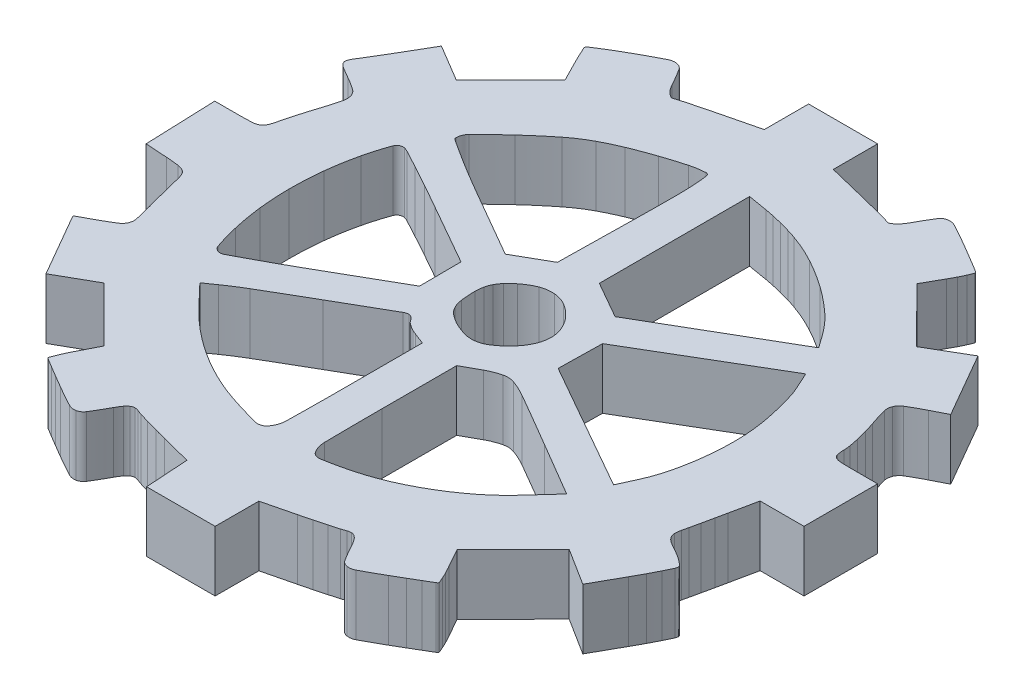
from build123d import *

# Parameters (mm, degrees)
BOSS_EXTRUDE2_DEPTH = 1
SCALE1_SCALE        = 25


with BuildPart() as part:
    # Sketch1 → Boss-Extrude2 (new body)
    with BuildSketch(Plane(origin=(0, 0, 0), x_dir=(1, 0, 0), z_dir=(0, 1, 0))):
        with BuildLine():
            Line((6921.747440723, 9184.288829947), (6921.747440723, 9183.921762584))
            Line((6921.747440723, 9183.921762584), (6921.194990723, 9183.786313121))
            ThreePointArc((6921.194990723, 9183.786313121), (6921.085826929, 9183.759302328), (6920.976778916, 9183.731827835))
            ThreePointArc((6920.976778916, 9183.731827835), (6920.877395392, 9183.706267667), (6920.778156301, 9183.680152348))
            ThreePointArc((6920.778156301, 9183.680152348), (6920.695117461, 9183.657870929), (6920.612169994, 9183.635251727))
            ThreePointArc((6920.612169994, 9183.635251727), (6920.581696467, 9183.625993034), (6920.551760767, 9183.615120449))
            ThreePointArc((6920.551760767, 9183.615120449), (6920.530041277, 9183.611412643), (6920.50865458, 9183.616712953))
            ThreePointArc((6920.50865458, 9183.616712953), (6920.479922998, 9183.632968304), (6920.453577753, 9183.652859718))
            ThreePointArc((6920.453577753, 9183.652859718), (6920.423190417, 9183.68206586), (6920.39606024, 9183.7143202))
            ThreePointArc((6920.39606024, 9183.7143202), (6920.369033733, 9183.75309256), (6920.344999001, 9183.793787275))
            ThreePointArc((6920.344999001, 9183.793787275), (6920.264288851, 9183.937151041), (6920.178781884, 9184.07770657))
            ThreePointArc((6920.178781884, 9184.07770657), (6920.135311918, 9184.12257325), (6920.077505378, 9184.146259976))
            ThreePointArc((6920.077505378, 9184.146259976), (6920.010208867, 9184.147556371), (6919.946060759, 9184.127172028))
            ThreePointArc((6919.946060759, 9184.127172028), (6919.764517255, 9184.032465207), (6919.584842889, 9183.934258546))
            ThreePointArc((6919.584842889, 9183.934258546), (6919.487894186, 9183.879418137), (6919.391485999, 9183.823632986))
            ThreePointArc((6919.391485999, 9183.823632986), (6919.309662911, 9183.774892753), (6919.22860888, 9183.724884034))
            ThreePointArc((6919.22860888, 9183.724884034), (6919.159887773, 9183.681478172), (6919.091406436, 9183.637695004))
            ThreePointArc((6919.091406436, 9183.637695004), (6919.083360598, 9183.629048012), (6919.080440723, 9183.61760335))
            ThreePointArc((6919.080440723, 9183.61760335), (6919.081695775, 9183.605571698), (6919.085406905, 9183.594058083))
            ThreePointArc((6919.085406905, 9183.594058083), (6919.105309047, 9183.549382505), (6919.125509441, 9183.504840989))
            ThreePointArc((6919.125509441, 9183.504840989), (6919.149963229, 9183.452277609), (6919.175079751, 9183.400027661))
            ThreePointArc((6919.175079751, 9183.400027661), (6919.204217902, 9183.341030009), (6919.233866222, 9183.282287078))
            Line((6919.233866222, 9183.282287078), (6919.387291722, 9182.981548234))
            Line((6919.387291722, 9182.981548234), (6918.937246369, 9182.53150288))
            Line((6918.937246369, 9182.53150288), (6918.487201015, 9182.081457527))
            Line((6918.487201015, 9182.081457527), (6918.181462003, 9182.263778219))
            Line((6918.181462003, 9182.263778219), (6917.875723066, 9182.446098987))
            Line((6917.875723066, 9182.446098987), (6917.665374566, 9182.084148073))
            ThreePointArc((6917.665374566, 9182.084148073), (6917.621370149, 9182.008753708), (6917.577084065, 9181.933524447))
            ThreePointArc((6917.577084065, 9181.933524447), (6917.53155033, 9181.856812764), (6917.485748078, 9181.780261101))
            ThreePointArc((6917.485748078, 9181.780261101), (6917.444867268, 9181.712473862), (6917.403750401, 9181.644829546))
            ThreePointArc((6917.403750401, 9181.644829546), (6917.376768388, 9181.601206039), (6917.34926321, 9181.557910492))
            ThreePointArc((6917.34926321, 9181.557910492), (6917.321496434, 9181.509132302), (6917.2991992, 9181.457623672))
            ThreePointArc((6917.2991992, 9181.457623672), (6917.294825961, 9181.424230965), (6917.305337415, 9181.392235537))
            ThreePointArc((6917.305337415, 9181.392235537), (6917.332293838, 9181.357460395), (6917.366643363, 9181.329963678))
            ThreePointArc((6917.366643363, 9181.329963678), (6917.458890692, 9181.273955219), (6917.5523705, 9181.220028947))
            ThreePointArc((6917.5523705, 9181.220028947), (6917.660813164, 9181.1552262), (6917.765656281, 9181.084748344))
            ThreePointArc((6917.765656281, 9181.084748344), (6917.811093989, 9181.039333836), (6917.839167259, 9180.981550151))
            ThreePointArc((6917.839167259, 9180.981550151), (6917.849727433, 9180.912453014), (6917.841628595, 9180.843024342))
            ThreePointArc((6917.841628595, 9180.843024342), (6917.79975148, 9180.688664606), (6917.753292831, 9180.535621426))
            ThreePointArc((6917.753292831, 9180.535621426), (6917.730593698, 9180.463459434), (6917.708598483, 9180.39107978))
            ThreePointArc((6917.708598483, 9180.39107978), (6917.685774646, 9180.313509825), (6917.663570379, 9180.235760253))
            ThreePointArc((6917.663570379, 9180.235760253), (6917.643724028, 9180.164095816), (6917.624455928, 9180.092273748))
            ThreePointArc((6917.624455928, 9180.092273748), (6917.611398967, 9180.040593145), (6917.599441069, 9179.988647234))
            ThreePointArc((6917.599441069, 9179.988647234), (6917.582736182, 9179.928042081), (6917.559677318, 9179.869558522))
            ThreePointArc((6917.559677318, 9179.869558522), (6917.536169503, 9179.83524724), (6917.502476569, 9179.810861433))
            ThreePointArc((6917.502476569, 9179.810861433), (6917.453205805, 9179.792687091), (6917.401285712, 9179.784799204))
            ThreePointArc((6917.401285712, 9179.784799204), (6917.286069956, 9179.78052291), (6917.170783684, 9179.779097234))
            Line((6917.170783684, 9179.779097234), (6916.788030093, 9179.779097234))
            Line((6916.788030093, 9179.779097234), (6916.810285446, 9179.188547234))
            Line((6916.810285446, 9179.188547234), (6916.832540723, 9178.597997234))
            Line((6916.832540723, 9178.597997234), (6917.194082672, 9178.574788848))
            ThreePointArc((6917.194082672, 9178.574788848), (6917.298237252, 9178.566474134), (6917.402082764, 9178.554923356))
            ThreePointArc((6917.402082764, 9178.554923356), (6917.454321, 9178.543089976), (6917.503322465, 9178.521463174))
            ThreePointArc((6917.503322465, 9178.521463174), (6917.537201906, 9178.494937135), (6917.561574317, 9178.459476836))
            ThreePointArc((6917.561574317, 9178.459476836), (6917.584490121, 9178.403978817), (6917.600783789, 9178.346188848))
            ThreePointArc((6917.600783789, 9178.346188848), (6917.612852086, 9178.292985854), (6917.625625294, 9178.239947684))
            ThreePointArc((6917.625625294, 9178.239947684), (6917.645591237, 9178.160092836), (6917.66588282, 9178.080320114))
            ThreePointArc((6917.66588282, 9178.080320114), (6917.688956193, 9177.991136237), (6917.712393243, 9177.902047242))
            ThreePointArc((6917.712393243, 9177.902047242), (6917.735495047, 9177.815734545), (6917.758982609, 9177.729526022))
            ThreePointArc((6917.758982609, 9177.729526022), (6917.796596702, 9177.584378533), (6917.829938068, 9177.43819041))
            ThreePointArc((6917.829938068, 9177.43819041), (6917.833095082, 9177.377749813), (6917.817384651, 9177.319301417))
            ThreePointArc((6917.817384651, 9177.319301417), (6917.784213495, 9177.267603381), (6917.737206554, 9177.228064033))
            ThreePointArc((6917.737206554, 9177.228064033), (6917.602142808, 9177.147875691), (6917.465032651, 9177.071238947))
            Line((6917.465032651, 9177.071238947), (6917.259324655, 9176.959757051))
            Line((6917.259324655, 9176.959757051), (6917.563326002, 9176.432473778))
            Line((6917.563326002, 9176.432473778), (6917.86732735, 9175.905190504))
            Line((6917.86732735, 9175.905190504), (6918.173456735, 9176.07907517))
            Line((6918.173456735, 9176.07907517), (6918.479586121, 9176.252959837))
            Line((6918.479586121, 9176.252959837), (6918.931379578, 9175.801166379))
            Line((6918.931379578, 9175.801166379), (6919.383173036, 9175.349372921))
            Line((6919.383173036, 9175.349372921), (6919.226491053, 9175.042250879))
            ThreePointArc((6919.226491053, 9175.042250879), (6919.196819352, 9174.982814303), (6919.168189138, 9174.922869101))
            ThreePointArc((6919.168189138, 9174.922869101), (6919.144866453, 9174.87105549), (6919.12299187, 9174.81861409))
            ThreePointArc((6919.12299187, 9174.81861409), (6919.105963647, 9174.775172656), (6919.089607888, 9174.731473598))
            ThreePointArc((6919.089607888, 9174.731473598), (6919.089000512, 9174.721157309), (6919.094174935, 9174.712211915))
            ThreePointArc((6919.094174935, 9174.712211915), (6919.103798436, 9174.704072762), (6919.114225364, 9174.696992032))
            ThreePointArc((6919.114225364, 9174.696992032), (6919.184052354, 9174.654834379), (6919.253933416, 9174.612766419))
            ThreePointArc((6919.253933416, 9174.612766419), (6919.334909361, 9174.564300222), (6919.416069566, 9174.516143219))
            ThreePointArc((6919.416069566, 9174.516143219), (6919.50987499, 9174.460882255), (6919.603817832, 9174.405855225))
            ThreePointArc((6919.603817832, 9174.405855225), (6919.776580624, 9174.307278913), (6919.951302634, 9174.212218452))
            ThreePointArc((6919.951302634, 9174.212218452), (6920.013668597, 9174.191601391), (6920.079342789, 9174.192816713))
            ThreePointArc((6920.079342789, 9174.192816713), (6920.136284543, 9174.216431521), (6920.179028315, 9174.260849902))
            ThreePointArc((6920.179028315, 9174.260849902), (6920.264664599, 9174.402338653), (6920.345679544, 9174.546523321))
            ThreePointArc((6920.345679544, 9174.546523321), (6920.3751525, 9174.597224978), (6920.407692094, 9174.646015222))
            ThreePointArc((6920.407692094, 9174.646015222), (6920.433744096, 9174.676179132), (6920.464944126, 9174.700980873))
            ThreePointArc((6920.464944126, 9174.700980873), (6920.493279321, 9174.714306333), (6920.524180177, 9174.719364809))
            ThreePointArc((6920.524180177, 9174.719364809), (6920.558071605, 9174.716473116), (6920.590541309, 9174.706338571))
            ThreePointArc((6920.590541309, 9174.706338571), (6920.628867759, 9174.690862834), (6920.667986646, 9174.677516378))
            ThreePointArc((6920.667986646, 9174.677516378), (6920.74718247, 9174.65326426), (6920.826576524, 9174.629669179))
            ThreePointArc((6920.826576524, 9174.629669179), (6920.92066949, 9174.6026028), (6921.015009523, 9174.576410561))
            ThreePointArc((6921.015009523, 9174.576410561), (6921.114420185, 9174.549732653), (6921.214040723, 9174.523849477))
            Line((6921.214040723, 9174.523849477), (6921.709340723, 9174.397271219))
            Line((6921.709340723, 9174.397271219), (6921.732565797, 9174.040184227))
            Line((6921.732565797, 9174.040184227), (6921.755790871, 9173.683097234))
            Line((6921.755790871, 9173.683097234), (6922.323115797, 9173.683097234))
            Line((6922.323115797, 9173.683097234), (6922.890440723, 9173.683097234))
            Line((6922.890440723, 9173.683097234), (6922.89097839, 9174.045047234))
            Line((6922.89097839, 9174.045047234), (6922.891516057, 9174.406997234))
            Line((6922.891516057, 9174.406997234), (6923.40532839, 9174.533029215))
            ThreePointArc((6923.40532839, 9174.533029215), (6923.508476724, 9174.55869932), (6923.611449542, 9174.585064671))
            ThreePointArc((6923.611449542, 9174.585064671), (6923.708761782, 9174.610743661), (6923.805866908, 9174.637195072))
            ThreePointArc((6923.805866908, 9174.637195072), (6923.887683742, 9174.660139265), (6923.969338387, 9174.683654136))
            ThreePointArc((6923.969338387, 9174.683654136), (6924.008672578, 9174.696191826), (6924.047340136, 9174.710655301))
            ThreePointArc((6924.047340136, 9174.710655301), (6924.079571763, 9174.719548321), (6924.112977673, 9174.720965618))
            ThreePointArc((6924.112977673, 9174.720965618), (6924.144266999, 9174.71459418), (6924.172870187, 9174.7004))
            ThreePointArc((6924.172870187, 9174.7004), (6924.204404181, 9174.67492367), (6924.230927577, 9174.644265137))
            ThreePointArc((6924.230927577, 9174.644265137), (6924.263134522, 9174.596378325), (6924.292201902, 9174.546523321))
            ThreePointArc((6924.292201902, 9174.546523321), (6924.371167996, 9174.406319255), (6924.454907876, 9174.268913081))
            ThreePointArc((6924.454907876, 9174.268913081), (6924.497756479, 9174.224874725), (6924.554709226, 9174.201814714))
            ThreePointArc((6924.554709226, 9174.201814714), (6924.620795611, 9174.20102205), (6924.683550548, 9174.221755034))
            ThreePointArc((6924.683550548, 9174.221755034), (6924.858403916, 9174.316079208), (6925.031321938, 9174.413906136))
            ThreePointArc((6925.031321938, 9174.413906136), (6925.125854708, 9174.468763329), (6925.220290013, 9174.523788136))
            ThreePointArc((6925.220290013, 9174.523788136), (6925.302130187, 9174.571719956), (6925.383840359, 9174.61987306))
            Line((6925.383840359, 9174.61987306), (6925.524808378, 9174.703382011))
            ThreePointArc((6925.524808378, 9174.703382011), (6925.535714594, 9174.710404967), (6925.546081665, 9174.718201844))
            ThreePointArc((6925.546081665, 9174.718201844), (6925.551644853, 9174.726855392), (6925.550975153, 9174.737121085))
            ThreePointArc((6925.550975153, 9174.737121085), (6925.533133249, 9174.780305771), (6925.514568241, 9174.823184566))
            ThreePointArc((6925.514568241, 9174.823184566), (6925.490591254, 9174.875234731), (6925.465096838, 9174.926558705))
            ThreePointArc((6925.465096838, 9174.926558705), (6925.433712339, 9174.986144008), (6925.401250916, 9175.045149527))
            Line((6925.401250916, 9175.045149527), (6925.229679301, 9175.350419986))
            Line((6925.229679301, 9175.350419986), (6925.692040327, 9175.817103914))
            Line((6925.692040327, 9175.817103914), (6926.154401353, 9176.283787918))
            Line((6926.154401353, 9176.283787918), (6926.460278897, 9176.090695899))
            Line((6926.460278897, 9176.090695899), (6926.766156441, 9175.89760388))
            Line((6926.766156441, 9175.89760388), (6927.038098544, 9176.383881952))
            ThreePointArc((6927.038098544, 9176.383881952), (6927.090703132, 9176.479138184), (6927.142287413, 9176.574950785))
            ThreePointArc((6927.142287413, 9176.574950785), (6927.186880391, 9176.660422722), (6927.230157748, 9176.746568273))
            ThreePointArc((6927.230157748, 9176.746568273), (6927.265568108, 9176.819244253), (6927.300323546, 9176.892235698))
            ThreePointArc((6927.300323546, 9176.892235698), (6927.307581821, 9176.913431567), (6927.310040723, 9176.935700407))
            ThreePointArc((6927.310040723, 9176.935700407), (6927.306253306, 9176.95393162), (6927.295517841, 9176.969145806))
            ThreePointArc((6927.295517841, 9176.969145806), (6927.263358258, 9176.997870592), (6927.229942636, 9177.025124002))
            ThreePointArc((6927.229942636, 9177.025124002), (6927.186639835, 9177.057175506), (6927.141815583, 9177.087062258))
            ThreePointArc((6927.141815583, 9177.087062258), (6927.090121232, 9177.118481554), (6927.037366414, 9177.148085732))
            ThreePointArc((6927.037366414, 9177.148085732), (6926.963421776, 9177.189988968), (6926.891352508, 9177.235041286))
            ThreePointArc((6926.891352508, 9177.235041286), (6926.853410547, 9177.265797621), (6926.822405147, 9177.303536323))
            ThreePointArc((6926.822405147, 9177.303536323), (6926.804919953, 9177.34035611), (6926.798571083, 9177.380619253))
            ThreePointArc((6926.798571083, 9177.380619253), (6926.801207566, 9177.435306036), (6926.810489296, 9177.489263841))
            ThreePointArc((6926.810489296, 9177.489263841), (6926.822461461, 9177.540837691), (6926.834088436, 9177.592490457))
            ThreePointArc((6926.834088436, 9177.592490457), (6926.852035473, 9177.673837956), (6926.869832637, 9177.755218376))
            ThreePointArc((6926.869832637, 9177.755218376), (6926.889827179, 9177.847464079), (6926.909650109, 9177.939746811))
            ThreePointArc((6926.909650109, 9177.939746811), (6926.929012589, 9178.030728288), (6926.948198165, 9178.121747234))
            Line((6926.948198165, 9178.121747234), (6927.040109767, 9178.559897234))
            Line((6927.040109767, 9178.559897234), (6927.403675207, 9178.559897234))
            Line((6927.403675207, 9178.559897234), (6927.767240723, 9178.559897234))
            Line((6927.767240723, 9178.559897234), (6927.767240723, 9179.169497234))
            Line((6927.767240723, 9179.169497234), (6927.767240723, 9179.779097234))
            Line((6927.767240723, 9179.779097234), (6927.386240723, 9179.779097234))
            ThreePointArc((6927.386240723, 9179.779097234), (6927.267350965, 9179.780297659), (6927.148509677, 9179.783898215))
            ThreePointArc((6927.148509677, 9179.783898215), (6927.102221093, 9179.791145773), (6927.058801246, 9179.808749093))
            ThreePointArc((6927.058801246, 9179.808749093), (6927.031378777, 9179.832579983), (6927.016409509, 9179.865683218))
            ThreePointArc((6927.016409509, 9179.865683218), (6927.0065436, 9179.926827858), (6927.002753098, 9179.988647234))
            ThreePointArc((6927.002753098, 9179.988647234), (6926.999907657, 9180.042485008), (6926.992669171, 9180.095909783))
            ThreePointArc((6926.992669171, 9180.095909783), (6926.97753385, 9180.175284671), (6926.960368981, 9180.254245535))
            ThreePointArc((6926.960368981, 9180.254245535), (6926.938844618, 9180.342360789), (6926.915086979, 9180.429900327))
            ThreePointArc((6926.915086979, 9180.429900327), (6926.889680948, 9180.514589686), (6926.861960034, 9180.598549825))
            ThreePointArc((6926.861960034, 9180.598549825), (6926.816318303, 9180.739157731), (6926.77598045, 9180.881378012))
            ThreePointArc((6926.77598045, 9180.881378012), (6926.769782902, 9180.946547173), (6926.784757775, 9181.010274579))
            ThreePointArc((6926.784757775, 9181.010274579), (6926.819415066, 9181.066454542), (6926.86991318, 9181.108966381))
            ThreePointArc((6926.86991318, 9181.108966381), (6927.001035177, 9181.184547888), (6927.134748795, 9181.255443659))
            Line((6927.134748795, 9181.255443659), (6927.378556791, 9181.379237417))
            Line((6927.378556791, 9181.379237417), (6927.071290959, 9181.912182808))
            Line((6927.071290959, 9181.912182808), (6926.764025127, 9182.445128275))
            Line((6926.764025127, 9182.445128275), (6926.442515839, 9182.256711202))
            Line((6926.442515839, 9182.256711202), (6926.121006474, 9182.068294205))
            Line((6926.121006474, 9182.068294205), (6925.671838259, 9182.522198708))
            Line((6925.671838259, 9182.522198708), (6925.222670044, 9182.976103134))
            Line((6925.222670044, 9182.976103134), (6925.397746325, 9183.287609267))
            ThreePointArc((6925.397746325, 9183.287609267), (6925.430904686, 9183.347921424), (6925.462928415, 9183.40884362))
            ThreePointArc((6925.462928415, 9183.40884362), (6925.489026566, 9183.46156393), (6925.513538779, 9183.515040055))
            ThreePointArc((6925.513538779, 9183.515040055), (6925.532496033, 9183.559128438), (6925.550676144, 9183.603542926))
            ThreePointArc((6925.550676144, 9183.603542926), (6925.55158592, 9183.614681366), (6925.546081665, 9183.6244074))
            ThreePointArc((6925.546081665, 9183.6244074), (6925.535606657, 9183.633312871), (6925.524248689, 9183.641060758))
            ThreePointArc((6925.524248689, 9183.641060758), (6925.454479681, 9183.683349237), (6925.384645717, 9183.725530363))
            ThreePointArc((6925.384645717, 9183.725530363), (6925.303413434, 9183.774278086), (6925.221976547, 9183.822683229))
            ThreePointArc((6925.221976547, 9183.822683229), (6925.128096682, 9183.878041554), (6925.034063614, 9183.933139244))
            ThreePointArc((6925.034063614, 9183.933139244), (6924.861361968, 9184.031684143), (6924.68670439, 9184.126719324))
            ThreePointArc((6924.68670439, 9184.126719324), (6924.624345166, 9184.147363873), (6924.558667358, 9184.14622561))
            ThreePointArc((6924.558667358, 9184.14622561), (6924.501759177, 9184.122711244), (6924.459028086, 9184.078377053))
            ThreePointArc((6924.459028086, 9184.078377053), (6924.373637708, 9183.937435171), (6924.292882444, 9183.793787275))
            ThreePointArc((6924.292882444, 9183.793787275), (6924.268847713, 9183.75309256), (6924.241821205, 9183.7143202))
            ThreePointArc((6924.241821205, 9183.7143202), (6924.214691029, 9183.68206586), (6924.184303693, 9183.652859718))
            ThreePointArc((6924.184303693, 9183.652859718), (6924.157958448, 9183.632968304), (6924.129226866, 9183.616712953))
            ThreePointArc((6924.129226866, 9183.616712953), (6924.107840169, 9183.611412643), (6924.086120678, 9183.615120449))
            ThreePointArc((6924.086120678, 9183.615120449), (6924.056184979, 9183.625993034), (6924.025711452, 9183.635251727))
            ThreePointArc((6924.025711452, 9183.635251727), (6923.942763985, 9183.657870929), (6923.859725144, 9183.680152348))
            ThreePointArc((6923.859725144, 9183.680152348), (6923.760486053, 9183.706267667), (6923.661102529, 9183.731827835))
            ThreePointArc((6923.661102529, 9183.731827835), (6923.552054517, 9183.759302328), (6923.442890723, 9183.786313121))
            Line((6923.442890723, 9183.786313121), (6922.890440723, 9183.921762584))
            Line((6922.890440723, 9183.921762584), (6922.890440723, 9184.288829947))
            Line((6922.890440723, 9184.288829947), (6922.890440723, 9184.655897234))
            Line((6922.890440723, 9184.655897234), (6922.318940723, 9184.655897234))
            Line((6922.318940723, 9184.655897234), (6921.747440723, 9184.655897234))
            Line((6921.747440723, 9184.655897234), (6921.747440723, 9184.288829947))
        make_face()
        with BuildLine():
            Line((6921.958833163, 9181.56563359), (6921.937940723, 9180.304169946))
            Line((6921.937940723, 9180.304169946), (6921.663331468, 9180.147322838))
            Line((6921.663331468, 9180.147322838), (6921.388722136, 9179.990475806))
            Line((6921.388722136, 9179.990475806), (6920.350302674, 9180.589636558))
            ThreePointArc((6920.350302674, 9180.589636558), (6920.150730637, 9180.70588586), (6919.952122546, 9180.823774469))
            ThreePointArc((6919.952122546, 9180.823774469), (6919.78362963, 9180.92624245), (6919.616501398, 9181.030921502))
            ThreePointArc((6919.616501398, 9181.030921502), (6919.473468326, 9181.12223275), (6919.3308055, 9181.21412139))
            ThreePointArc((6919.3308055, 9181.21412139), (6919.316116128, 9181.229789301), (6919.310461929, 9181.250508643))
            ThreePointArc((6919.310461929, 9181.250508643), (6919.325786455, 9181.335394677), (6919.373192969, 9181.407457859))
            ThreePointArc((6919.373192969, 9181.407457859), (6919.565831576, 9181.596500463), (6919.762698718, 9181.78113542))
            ThreePointArc((6919.762698718, 9181.78113542), (6919.968948524, 9181.963416071), (6920.181711317, 9182.138050581))
            ThreePointArc((6920.181711317, 9182.138050581), (6920.34578931, 9182.256232751), (6920.519791895, 9182.359245922))
            ThreePointArc((6920.519791895, 9182.359245922), (6920.683094627, 9182.441129993), (6920.850271905, 9182.514781476))
            ThreePointArc((6920.850271905, 9182.514781476), (6921.048951403, 9182.592849151), (6921.249979538, 9182.664653008))
            ThreePointArc((6921.249979538, 9182.664653008), (6921.440031663, 9182.726041709), (6921.631835188, 9182.781717467))
            ThreePointArc((6921.631835188, 9182.781717467), (6921.756143534, 9182.808676388), (6921.882633163, 9182.822082436))
            ThreePointArc((6921.882633163, 9182.822082436), (6921.915531859, 9182.811284375), (6921.932621048, 9182.781169894))
            ThreePointArc((6921.932621048, 9182.781169894), (6921.946288897, 9182.673011074), (6921.955249172, 9182.56436093))
            ThreePointArc((6921.955249172, 9182.56436093), (6921.963194107, 9182.385797107), (6921.965383086, 9182.207070026))
            ThreePointArc((6921.965383086, 9182.207070026), (6921.963126405, 9181.88634141), (6921.958833163, 9181.56563359))
        make_face(mode=Mode.SUBTRACT)
        with BuildLine():
            Line((6925.177346131, 9181.454225761), (6925.328346032, 9181.242165962))
            Line((6925.328346032, 9181.242165962), (6924.261921775, 9180.62258239))
            Line((6924.261921775, 9180.62258239), (6923.195497517, 9180.002998895))
            Line((6923.195497517, 9180.002998895), (6922.891156012, 9180.176798065))
            Line((6922.891156012, 9180.176798065), (6922.586814508, 9180.350597234))
            Line((6922.586814508, 9180.350597234), (6922.586227615, 9181.595545062))
            Line((6922.586227615, 9181.595545062), (6922.585640723, 9182.84049289))
            Line((6922.585640723, 9182.84049289), (6922.908484121, 9182.785948853))
            ThreePointArc((6922.908484121, 9182.785948853), (6922.981471065, 9182.772615453), (6923.054076946, 9182.757342611))
            ThreePointArc((6923.054076946, 9182.757342611), (6923.139997906, 9182.737350238), (6923.225589506, 9182.715991767))
            ThreePointArc((6923.225589506, 9182.715991767), (6923.31056286, 9182.693343321), (6923.395164377, 9182.669343194))
            ThreePointArc((6923.395164377, 9182.669343194), (6923.465208727, 9182.647822333), (6923.534637275, 9182.624390833))
            ThreePointArc((6923.534637275, 9182.624390833), (6923.770751044, 9182.530503506), (6923.998768199, 9182.41837537))
            ThreePointArc((6923.998768199, 9182.41837537), (6924.237364363, 9182.27954659), (6924.467003711, 9182.126356091))
            ThreePointArc((6924.467003711, 9182.126356091), (6924.679032565, 9181.965073421), (6924.880544998, 9181.790829127))
            ThreePointArc((6924.880544998, 9181.790829127), (6925.037693886, 9181.630241305), (6925.177346131, 9181.454225761))
        make_face(mode=Mode.SUBTRACT)
        with BuildLine():
            Line((6925.724916055, 9177.862603379), (6925.595540723, 9177.577763359))
            Line((6925.595540723, 9177.577763359), (6924.530592078, 9178.183487141))
            Line((6924.530592078, 9178.183487141), (6923.465643357, 9178.789210924))
            Line((6923.465643357, 9178.789210924), (6923.472089496, 9179.150804079))
            Line((6923.472089496, 9179.150804079), (6923.478535711, 9179.512397234))
            Line((6923.478535711, 9179.512397234), (6924.537038217, 9180.136499542))
            Line((6924.537038217, 9180.136499542), (6925.595540723, 9180.76060185))
            Line((6925.595540723, 9180.76060185), (6925.724916055, 9180.476076384))
            ThreePointArc((6925.724916055, 9180.476076384), (6925.754786421, 9180.404727618), (6925.780284118, 9180.33170192))
            ThreePointArc((6925.780284118, 9180.33170192), (6925.811474431, 9180.228706819), (6925.840268224, 9180.125016202))
            ThreePointArc((6925.840268224, 9180.125016202), (6925.869033168, 9180.011338755), (6925.895191813, 9179.897033422))
            ThreePointArc((6925.895191813, 9179.897033422), (6925.917052146, 9179.789059523), (6925.935928333, 9179.680524152))
            ThreePointArc((6925.935928333, 9179.680524152), (6925.963280307, 9179.453789893), (6925.973174664, 9179.225626231))
            ThreePointArc((6925.973174664, 9179.225626231), (6925.966947814, 9178.97813142), (6925.945825341, 9178.731461001))
            ThreePointArc((6925.945825341, 9178.731461001), (6925.910695121, 9178.492924396), (6925.861010017, 9178.256989585))
            ThreePointArc((6925.861010017, 9178.256989585), (6925.802243929, 9178.056593851), (6925.724916055, 9177.862603379))
        make_face(mode=Mode.SUBTRACT)
        with BuildLine():
            Line((6920.129848301, 9180.083897234), (6921.133364582, 9179.512397234))
            Line((6921.133364582, 9179.512397234), (6921.135602653, 9179.166700999))
            Line((6921.135602653, 9179.166700999), (6921.137840723, 9178.821004688))
            Line((6921.137840723, 9178.821004688), (6920.110765307, 9178.233250999))
            ThreePointArc((6920.110765307, 9178.233250999), (6919.911665874, 9178.120056058), (6919.711933211, 9178.007982235))
            ThreePointArc((6919.711933211, 9178.007982235), (6919.538543713, 9177.91231264), (6919.36433129, 9177.818149899))
            ThreePointArc((6919.36433129, 9177.818149899), (6919.213788118, 9177.737911077), (6919.063005706, 9177.658122736))
            ThreePointArc((6919.063005706, 9177.658122736), (6919.03826702, 9177.648700508), (6919.011989272, 9177.645497234))
            ThreePointArc((6919.011989272, 9177.645497234), (6918.939676797, 9177.668774295), (6918.894521562, 9177.729863741))
            ThreePointArc((6918.894521562, 9177.729863741), (6918.832474836, 9177.929578379), (6918.780036625, 9178.132028291))
            ThreePointArc((6918.780036625, 9178.132028291), (6918.730128271, 9178.377356871), (6918.694458005, 9178.625156362))
            ThreePointArc((6918.694458005, 9178.625156362), (6918.672583153, 9178.877864596), (6918.66476256, 9179.131397234))
            ThreePointArc((6918.66476256, 9179.131397234), (6918.671551981, 9179.406376867), (6918.693594278, 9179.680555699))
            ThreePointArc((6918.693594278, 9179.680555699), (6918.730321311, 9179.943012684), (6918.783262552, 9180.20268511))
            ThreePointArc((6918.783262552, 9180.20268511), (6918.83825335, 9180.409120549), (6918.904782349, 9180.61213156))
            ThreePointArc((6918.904782349, 9180.61213156), (6918.95480803, 9180.670013499), (6919.03074034, 9180.679350095))
            ThreePointArc((6919.03074034, 9180.679350095), (6919.064799442, 9180.668559129), (6919.097283056, 9180.653683573))
            ThreePointArc((6919.097283056, 9180.653683573), (6919.2452734, 9180.574332064), (6919.393034916, 9180.494555265))
            ThreePointArc((6919.393034916, 9180.494555265), (6919.566008605, 9180.400136379), (6919.738381927, 9180.304625851))
            ThreePointArc((6919.738381927, 9180.304625851), (6919.934350963, 9180.194679824), (6920.129848301, 9180.083897234))
        make_face(mode=Mode.SUBTRACT)
        with BuildLine():
            Line((6921.792942715, 9178.099883016), (6921.976040723, 9178.030269287))
            Line((6921.976040723, 9178.030269287), (6921.976040723, 9176.771083261))
            ThreePointArc((6921.976040723, 9176.771083261), (6921.973965299, 9176.278857043), (6921.967739571, 9175.786665824))
            ThreePointArc((6921.967739571, 9175.786665824), (6921.94887711, 9175.673942414), (6921.897762901, 9175.571718654))
            ThreePointArc((6921.897762901, 9175.571718654), (6921.825192414, 9175.515850174), (6921.733730819, 9175.511102621))
            ThreePointArc((6921.733730819, 9175.511102621), (6921.466009996, 9175.584885992), (6921.20123036, 9175.668612745))
            ThreePointArc((6921.20123036, 9175.668612745), (6920.983535919, 9175.74983397), (6920.77151349, 9175.844882624))
            ThreePointArc((6920.77151349, 9175.844882624), (6920.560082693, 9175.955829577), (6920.355597431, 9176.079109689))
            ThreePointArc((6920.355597431, 9176.079109689), (6920.156493441, 9176.21576136), (6919.965739333, 9176.363845619))
            ThreePointArc((6919.965739333, 9176.363845619), (6919.784924444, 9176.522171503), (6919.613840723, 9176.690965666))
            Line((6919.613840723, 9176.690965666), (6919.270940723, 9177.050015723))
            Line((6919.270940723, 9177.050015723), (6919.452008534, 9177.176306479))
            ThreePointArc((6919.452008534, 9177.176306479), (6919.609045672, 9177.281307157), (6919.770090271, 9177.380051486))
            ThreePointArc((6919.770090271, 9177.380051486), (6920.151630652, 9177.602730946), (6920.534088768, 9177.823830457))
            ThreePointArc((6920.534088768, 9177.823830457), (6920.95514261, 9178.065816729), (6921.376425666, 9178.307403734))
            ThreePointArc((6921.376425666, 9178.307403734), (6921.415404797, 9178.323718344), (6921.457193627, 9178.329981946))
            ThreePointArc((6921.457193627, 9178.329981946), (6921.469390883, 9178.328807212), (6921.480951263, 9178.324743882))
            ThreePointArc((6921.480951263, 9178.324743882), (6921.495450541, 9178.316650385), (6921.509067006, 9178.307146406))
            ThreePointArc((6921.509067006, 9178.307146406), (6921.523535016, 9178.294832337), (6921.536819884, 9178.281250294))
            ThreePointArc((6921.536819884, 9178.281250294), (6921.549008516, 9178.266327963), (6921.559845619, 9178.25039699))
            ThreePointArc((6921.559845619, 9178.25039699), (6921.574102733, 9178.231149044), (6921.591376036, 9178.214554415))
            ThreePointArc((6921.591376036, 9178.214554415), (6921.619595353, 9178.192905549), (6921.648942545, 9178.172812131))
            ThreePointArc((6921.648942545, 9178.172812131), (6921.683536986, 9178.151731676), (6921.719183553, 9178.132483738))
            ThreePointArc((6921.719183553, 9178.132483738), (6921.755632283, 9178.115208576), (6921.792942715, 9178.099883016))
        make_face(mode=Mode.SUBTRACT)
        with BuildLine():
            Line((6924.438071181, 9177.587865955), (6925.338001639, 9177.058202194))
            Line((6925.338001639, 9177.058202194), (6924.956431663, 9176.640703841))
            ThreePointArc((6924.956431663, 9176.640703841), (6924.787956854, 9176.470897836), (6924.606140263, 9176.315461134))
            ThreePointArc((6924.606140263, 9176.315461134), (6924.396846772, 9176.161470578), (6924.178129435, 9176.02118664))
            ThreePointArc((6924.178129435, 9176.02118664), (6923.94837177, 9175.893703298), (6923.71099387, 9175.781043102))
            ThreePointArc((6923.71099387, 9175.781043102), (6923.480267285, 9175.690593253), (6923.243369252, 9175.617824759))
            ThreePointArc((6923.243369252, 9175.617824759), (6923.019849067, 9175.563798932), (6922.794074469, 9175.520142379))
            ThreePointArc((6922.794074469, 9175.520142379), (6922.711462546, 9175.531382261), (6922.649980955, 9175.587694594))
            ThreePointArc((6922.649980955, 9175.587694594), (6922.607758104, 9175.688113992), (6922.592354324, 9175.795954375))
            ThreePointArc((6922.592354324, 9175.795954375), (6922.587433972, 9176.273039439), (6922.585846615, 9176.750147234))
            Line((6922.585846615, 9176.750147234), (6922.586052508, 9177.988397234))
            Line((6922.586052508, 9177.988397234), (6922.871596615, 9178.146491889))
            ThreePointArc((6922.871596615, 9178.146491889), (6922.983454164, 9178.199056201), (6923.10128338, 9178.236357597))
            ThreePointArc((6923.10128338, 9178.236357597), (6923.195104623, 9178.245253971), (6923.287526543, 9178.226821396))
            ThreePointArc((6923.287526543, 9178.226821396), (6923.423308, 9178.171336802), (6923.5535031, 9178.103776607))
            ThreePointArc((6923.5535031, 9178.103776607), (6923.996298666, 9177.846698331), (6924.438071181, 9177.587865955))
        make_face(mode=Mode.SUBTRACT)
        with BuildLine():
            ThreePointArc((6922.926292289, 9179.371232239), (6922.869841833, 9179.483426965), (6922.795190723, 9179.584429552))
            ThreePointArc((6922.795190723, 9179.584429552), (6922.698867903, 9179.67827402), (6922.589324536, 9179.756281202))
            ThreePointArc((6922.589324536, 9179.756281202), (6922.481967213, 9179.805419734), (6922.366339256, 9179.829302062))
            ThreePointArc((6922.366339256, 9179.829302062), (6922.249952212, 9179.826478037), (6922.137282971, 9179.797159759))
            ThreePointArc((6922.137282971, 9179.797159759), (6922.020027031, 9179.740204307), (6921.913710342, 9179.664774603))
            ThreePointArc((6921.913710342, 9179.664774603), (6921.853541073, 9179.610815667), (6921.796891856, 9179.553172159))
            ThreePointArc((6921.796891856, 9179.553172159), (6921.757022208, 9179.503935866), (6921.723818189, 9179.449979452))
            ThreePointArc((6921.723818189, 9179.449979452), (6921.700130294, 9179.396207745), (6921.68442698, 9179.339586912))
            ThreePointArc((6921.68442698, 9179.339586912), (6921.674545422, 9179.273648519), (6921.671240723, 9179.207055757))
            ThreePointArc((6921.671240723, 9179.207055757), (6921.674891754, 9179.089261848), (6921.685830813, 9178.971920159))
            ThreePointArc((6921.685830813, 9178.971920159), (6921.703080301, 9178.891098921), (6921.733958962, 9178.81444303))
            ThreePointArc((6921.733958962, 9178.81444303), (6921.774500254, 9178.751335685), (6921.826959766, 9178.697724746))
            ThreePointArc((6921.826959766, 9178.697724746), (6921.901437744, 9178.642251327), (6921.981490623, 9178.595178977))
            ThreePointArc((6921.981490623, 9178.595178977), (6922.090369793, 9178.545740496), (6922.203718398, 9178.507649409))
            ThreePointArc((6922.203718398, 9178.507649409), (6922.295990636, 9178.491937771), (6922.389514648, 9178.495716718))
            ThreePointArc((6922.389514648, 9178.495716718), (6922.479277555, 9178.518745966), (6922.562165713, 9178.560186032))
            ThreePointArc((6922.562165713, 9178.560186032), (6922.656978411, 9178.628409342), (6922.743902255, 9178.706435702))
            ThreePointArc((6922.743902255, 9178.706435702), (6922.830166265, 9178.806824491), (6922.900340779, 9178.919051609))
            ThreePointArc((6922.900340779, 9178.919051609), (6922.943769493, 9179.0287224), (6922.963095365, 9179.145084964))
            ThreePointArc((6922.963095365, 9179.145084964), (6922.957163701, 9179.260187941), (6922.926292289, 9179.371232239))
        make_face(mode=Mode.SUBTRACT)
    extrude(amount=BOSS_EXTRUDE2_DEPTH)


with BuildPart() as part_1:
    # Scale1: scaled about (6922.299004793, 0.5, -9179.167476673)
    add(part.part.scale(SCALE1_SCALE).moved(Location((-166135.176115032, -12, 220300.019440152))))


solid = part_1.part
